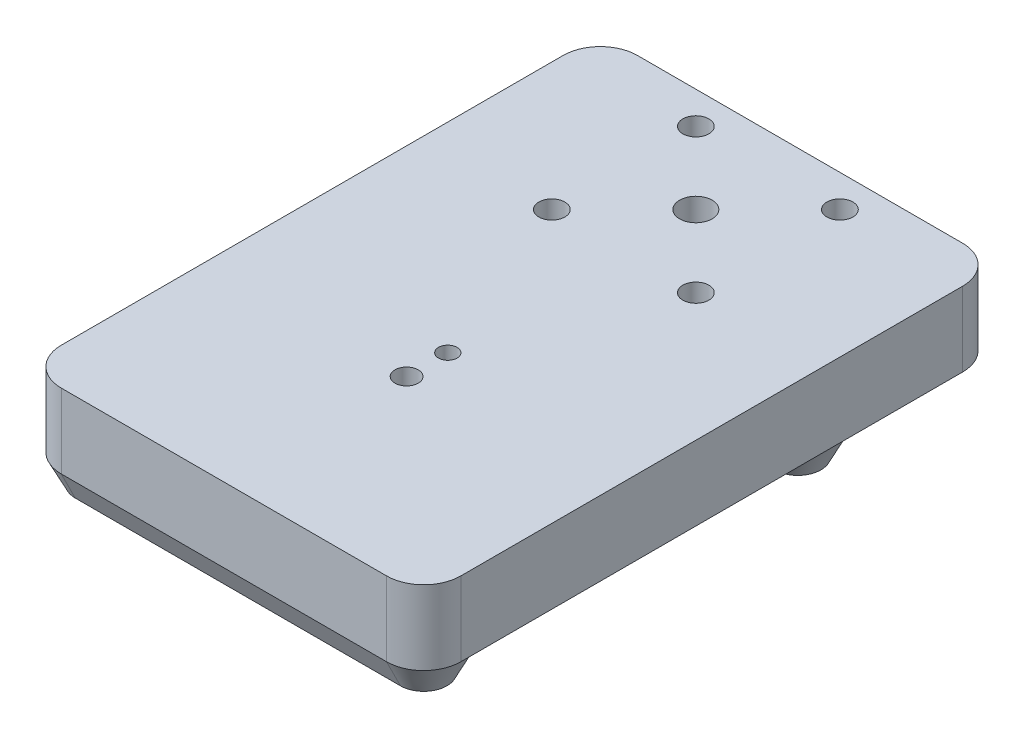
from build123d import *
from OCP.BRepFilletAPI import BRepFilletAPI_MakeChamfer

# Parameters (mm, degrees)
BOSS_EXTRUDE1_DEPTH            = 16
SKETCH17_R                     = 5
BOSS_EXTRUDE2_DEPTH            = 6
CUT_EXTRUDE7_REACH             = 80.594
SKETCH14_R                     = 3.5
SKETCH16_W                     = 80
SKETCH16_H                     = 10
CUT_EXTRUDE8_DEPTH             = 9.5
CHAMFER3_SIZE                  = 3
CHAMFER3_SIZE_2                = 6
CBORE_FOR_M3_SHCS1_D           = 3.2
CBORE_FOR_M3_SHCS1_CBORE_D     = 5.6
CBORE_FOR_M3_SHCS1_CBORE_DEPTH = 4
CHAMFER4_SIZE                  = 10
CHAMFER4_SIZE_2                = 16.00334529
F_5_0MM_DOWEL_HOLE1_D          = 5
F_5_0MM_DOWEL_HOLE1_DEPTH      = 19
F_4_0MM_DOWEL_HOLE1_D          = 4
F_5_0MM_DOWEL_HOLE2_D          = 5
FILLET2_R                      = 5
CUT_EXTRUDE9_DEPTH             = 6
FILLET3_R                      = 4
SKETCH13_R                     = 11.5
CUT_EXTRUDE6_DEPTH             = 3
CUT_EXTRUDE10_DEPTH            = 8
FILLET4_R                      = 2


# Some blends are built 0.0001 mm under size
with BuildPart() as part:
    # Sketch1 → Boss-Extrude1 (new body)
    with BuildSketch(Plane(origin=(0, 0, 0), x_dir=(1, 0, 0), z_dir=(0, 1, 0))):
        with BuildLine():
            Line((-35, 62), (35, 62))
            ThreePointArc((35, 62), (40.656854249, 59.656854249), (43, 54))
            Line((43, 54), (43, -54))
            ThreePointArc((43, -54), (40.656854249, -59.656854249), (35, -62))
            Line((35, -62), (-35, -62))
            ThreePointArc((-35, -62), (-40.656854249, -59.656854249), (-43, -54))
            Line((-43, -54), (-43, 54))
            ThreePointArc((-43, 54), (-40.656854249, 59.656854249), (-35, 62))
        make_face()
    extrude(amount=BOSS_EXTRUDE1_DEPTH)

    # Sketch17 → Boss-Extrude2 (add)
    with BuildSketch(Plane(origin=(0, 0, 0), x_dir=(-1, 0, 0), z_dir=(0, -1, 0))):
        with Locations(Location((35, 26.5, 0), (0, 0, 270))):
            Circle(SKETCH17_R)
        with Locations(Location((-35, 26.5, 0), (0, 0, 270))):
            Circle(SKETCH17_R)
        with BuildLine():
            Line((-35, -49), (35, -49))
            ThreePointArc((35, -49), (40, -54), (35, -59))
            Line((35, -59), (-35, -59))
            ThreePointArc((-35, -59), (-40, -54), (-35, -49))
        make_face()
    extrude(amount=BOSS_EXTRUDE2_DEPTH)

    # Sketch14 → Cut-Extrude7 (cut, up to next)
    with BuildSketch(Plane(origin=(0, 16, 0), x_dir=(1, 0, 0), z_dir=(0, 1, 0)), mode=Mode.PRIVATE) as cut_extrude7_sk1:
        with Locations(Location((0, 39.569999996, 0), (0, 0, 270))):
            Circle(SKETCH14_R)
    cut_extrude7_tool1 = extrude(cut_extrude7_sk1.sketch, amount=-CUT_EXTRUDE7_REACH, mode=Mode.PRIVATE) & part.part
    add(cut_extrude7_tool1.solids().sort_by_distance((0, 16, -39.57))[0], mode=Mode.SUBTRACT)

    # Sketch16 → Cut-Extrude8 (cut)
    with BuildSketch(Plane(origin=(0, 0, 0), x_dir=(-1, 0, 0), z_dir=(0, -1, 0))):
        with Locations((0, -13.82)):
            Rectangle(SKETCH16_W, SKETCH16_H)
    extrude(amount=-CUT_EXTRUDE8_DEPTH, mode=Mode.SUBTRACT)

    # Chamfer3
    chamfer3_edges_1 = [part.edges().sort_by_distance(p)[0] for p in [
        (40, 0, 54),
    ]]
    chamfer3_side_1 = [part.faces().sort_by_distance(p)[0] for p in [
        (40.06, 0, 54),
    ]]
    chamfer3_edges_2 = [part.edges().sort_by_distance(p)[0] for p in [
        (0, 0, 59),
    ]]
    chamfer3_side_2 = [part.faces().sort_by_distance(p)[0] for p in [
        (0, 0, 59.06),
    ]]
    chamfer3_edges_3 = [part.edges().sort_by_distance(p)[0] for p in [
        (0, 0, 49),
    ]]
    chamfer3_side_3 = [part.faces().sort_by_distance(p)[0] for p in [
        (0, 0, 48.94),
    ]]
    chamfer3_edges_4 = [part.edges().sort_by_distance(p)[0] for p in [
        (-40, 0, 54),
    ]]
    chamfer3_side_4 = [part.faces().sort_by_distance(p)[0] for p in [
        (-40.06, 0, 54),
    ]]
    chamfer3_edges_5 = [part.edges().sort_by_distance(p)[0] for p in [
        (-35, 0, -31.5),
    ]]
    chamfer3_side_5 = [part.faces().sort_by_distance(p)[0] for p in [
        (-35, 0, -31.56),
    ]]
    chamfer3_edges_6 = [part.edges().sort_by_distance(p)[0] for p in [
        (35, 0, -31.5),
    ]]
    chamfer3_side_6 = [part.faces().sort_by_distance(p)[0] for p in [
        (35, 0, -31.56),
    ]]
    chamfer3 = BRepFilletAPI_MakeChamfer(part.part.solid().wrapped)
    for e in chamfer3_edges_1:
        chamfer3.Add(CHAMFER3_SIZE - 0.0001, CHAMFER3_SIZE_2 - 0.0001, e.wrapped, chamfer3_side_1[0].wrapped)
    for e in chamfer3_edges_2:
        chamfer3.Add(CHAMFER3_SIZE - 0.0001, CHAMFER3_SIZE_2 - 0.0001, e.wrapped, chamfer3_side_2[0].wrapped)
    for e in chamfer3_edges_3:
        chamfer3.Add(CHAMFER3_SIZE - 0.0001, CHAMFER3_SIZE_2 - 0.0001, e.wrapped, chamfer3_side_3[0].wrapped)
    for e in chamfer3_edges_4:
        chamfer3.Add(CHAMFER3_SIZE - 0.0001, CHAMFER3_SIZE_2 - 0.0001, e.wrapped, chamfer3_side_4[0].wrapped)
    for e in chamfer3_edges_5:
        chamfer3.Add(CHAMFER3_SIZE - 0.0001, CHAMFER3_SIZE_2 - 0.0001, e.wrapped, chamfer3_side_5[0].wrapped)
    for e in chamfer3_edges_6:
        chamfer3.Add(CHAMFER3_SIZE - 0.0001, CHAMFER3_SIZE_2 - 0.0001, e.wrapped, chamfer3_side_6[0].wrapped)
    add(Compound.cast(chamfer3.Shape()), mode=Mode.REPLACE)  # a hair under: the kernel refuses the full size

    # CBORE for M3 SHCS1 (through all)
    with Locations(Plane(origin=(0, 16, 0), x_dir=(1, 0, 0), z_dir=(0, 1, 0))):
        with Locations((-15.5, 55.069999996), (-15.5, 24.069999996), (15.5, 24.069999996), (15.5, 55.069999996)):
            CounterBoreHole(CBORE_FOR_M3_SHCS1_D / 2, CBORE_FOR_M3_SHCS1_CBORE_D / 2, CBORE_FOR_M3_SHCS1_CBORE_DEPTH)

    # Chamfer4
    # the kernel refuses this chamfer: 16.00334529, 10 mm, written as the material it adds along each edge
    with BuildSketch(Plane(origin=(40, 9.5, -32.554216019), x_dir=(0.05243311939005598, -0.9986244379099823, 0), z_dir=(0, 0, 1))) as chamfer4_piece_1_section:
        Polygon((CHAMFER4_SIZE * 0.99862443791, -CHAMFER4_SIZE * 0.0524331193901), (-CHAMFER4_SIZE_2 * 0.0524331193914, -CHAMFER4_SIZE_2 * 0.998624437936), (0, 0), align=None)
    chamfer4_piece_1 = extrude(amount=92.748432037, mode=Mode.PRIVATE)
    chamfer4_piece_1 = split(chamfer4_piece_1, bisect_by=Plane(origin=(34.599202333, 0, -11.867108009), z_dir=(0, 1, 0)), keep=Keep.TOP, mode=Mode.PRIVATE)
    add(chamfer4_piece_1)
    with BuildSketch(Plane(origin=(-40, 9.5, 60.194216019), x_dir=(-0.05243311939005598, -0.9986244379099823, 0), z_dir=(0, 0, -1))) as chamfer4_piece_2_section:
        Polygon((CHAMFER4_SIZE * 0.99862443791, -CHAMFER4_SIZE * 0.0524331193901), (-CHAMFER4_SIZE_2 * 0.0524331193914, -CHAMFER4_SIZE_2 * 0.998624437936), (0, 0), align=None)
    chamfer4_piece_2 = extrude(amount=92.748432037, mode=Mode.PRIVATE)
    chamfer4_piece_2 = split(chamfer4_piece_2, bisect_by=Plane(origin=(-34.599202333, 0, 39.507108009), z_dir=(0, 1, 0)), keep=Keep.TOP, mode=Mode.PRIVATE)
    add(chamfer4_piece_2)

    # Ø5.0mm Dowel Hole1
    with Locations(Plane.XZ.offset(6)):
        with Locations((-35, 54), (35, 54), (-35, -26.5), (35, -26.5)):
            Hole(F_5_0MM_DOWEL_HOLE1_D / 2, depth=F_5_0MM_DOWEL_HOLE1_DEPTH)

    # Ø4.0mm Dowel Hole1 (through all)
    with Locations(Plane(origin=(0, 16, 0), x_dir=(1, 0, 0), z_dir=(0, 1, 0))):
        with Locations((0, -13.82)):
            Hole(F_4_0MM_DOWEL_HOLE1_D / 2)

    # Ø5.0mm Dowel Hole2 (through all)
    with Locations(Plane(origin=(0, 16, 0), x_dir=(1, 0, 0), z_dir=(0, 1, 0))):
        with Locations((0, -22.680000004)):
            Hole(F_5_0MM_DOWEL_HOLE2_D / 2)

    # Fillet2
    fillet2_edges = [part.edges().sort_by_distance(p)[0] for p in [
        (39.199832735, 0, 13.82),
        (-39.199832735, 0, 13.82),
    ]]
    fillet(fillet2_edges, radius=FILLET2_R)

    # Sketch26 → Cut-Extrude9 (cut)
    with BuildSketch(Plane.XZ):
        Polygon((22.15, -80.719999996), (-22.15, -80.719999996), (-22.15, -22.005786434), (-17.564213562, -17.419999996), (17.564213562, -17.419999996), (22.15, -22.005786434), align=None)
    extrude(amount=-CUT_EXTRUDE9_DEPTH, mode=Mode.SUBTRACT)

    # Fillet3
    fillet3_edges = [part.edges().sort_by_distance(p)[0] for p in [
        (-22.15, 3, -62),
        (22.15, 3, -62),
    ]]
    fillet(fillet3_edges, radius=FILLET3_R)

    # Sketch13 → Cut-Extrude6 (cut)
    with BuildSketch(Plane.XZ.offset(-6)):
        with Locations(Location((0, -39.569999996, 0), (0, 0, 270))):
            Circle(SKETCH13_R)
    extrude(amount=-CUT_EXTRUDE6_DEPTH, mode=Mode.SUBTRACT)

    # Sketch28 → Cut-Extrude10 (cut)
    with BuildSketch(Plane(origin=(0, 0, 0), x_dir=(-1, 0, 0), z_dir=(0, -1, 0))):
        Polygon((4.965212315, -22.680000004), (2.482606157, -18.380000004), (-2.482606158, -18.380000004), (-4.965212315, -22.680000004), (-2.482606158, -26.980000004), (2.482606157, -26.980000004), align=None)
    extrude(amount=-CUT_EXTRUDE10_DEPTH, mode=Mode.SUBTRACT)

    # Fillet4
    fillet4_edges = [part.edges().sort_by_distance(p)[0] for p in [
        (-3.850926294, 0, 20.750000002),
        (3.850926295, 0, 20.750000002),
        (3.723909237, 0, 24.830000004),
        (0, 0, 26.980000004),
        (-3.723909236, 0, 24.830000004),
    ]]
    fillet(fillet4_edges, radius=FILLET4_R)


solid = part.part
